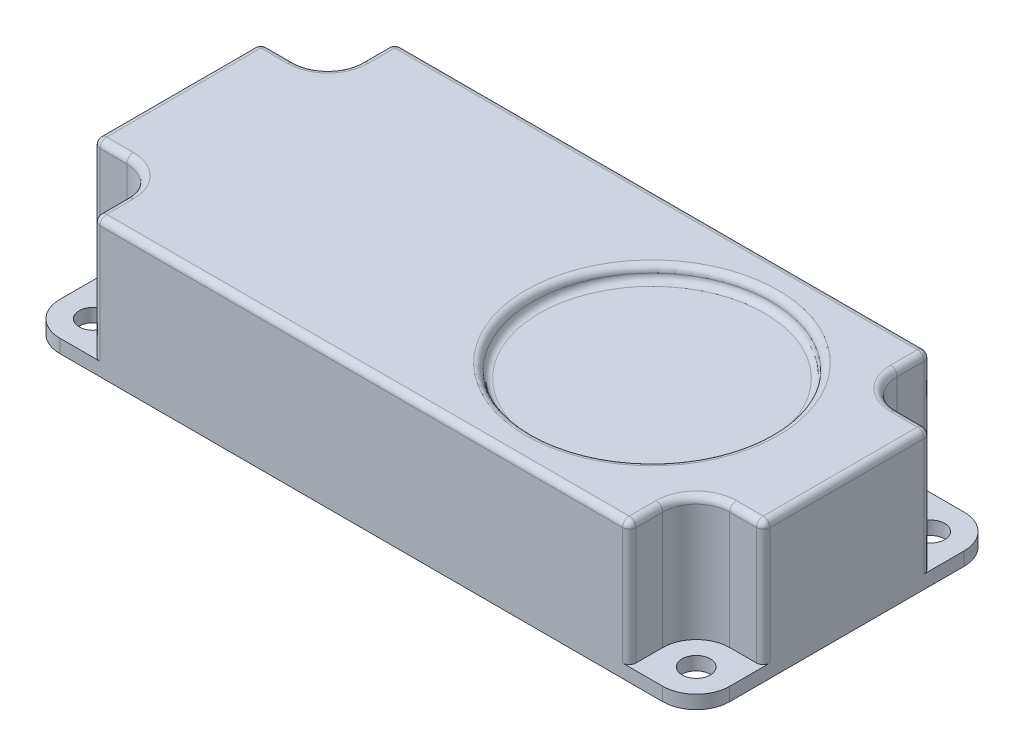
from build123d import *

# Parameters (mm, degrees)
EXTRUDE_1_DEPTH     = 2
EXTRUDE_3_DEPTH     = 18.5
FILLET_1_R          = 1
SKETCH_4_R          = 17.821315346
CUT_EXTRUDE_1_DEPTH = 2
FILLET_2_R          = 1
SKETCH_5_R          = 2.1
CUT_EXTRUDE_2_DEPTH = 2


with BuildPart() as part:
    # 草图1 → 凸台-拉伸1 (new body)
    with BuildSketch(Plane(origin=(0, 0, 0), x_dir=(1, 0, 0), z_dir=(0, 1, 0))):
        with BuildLine():
            Line((-45, -22.5), (45, -22.5))
            ThreePointArc((45, -22.5), (48.535533906, -21.035533906), (50, -17.5))
            Line((50, -17.5), (50, 17.5))
            ThreePointArc((50, 17.5), (48.535533906, 21.035533906), (45, 22.5))
            Line((45, 22.5), (-45, 22.5))
            ThreePointArc((-45, 22.5), (-48.535533906, 21.035533906), (-50, 17.5))
            Line((-50, 17.5), (-50, -17.5))
            ThreePointArc((-50, -17.5), (-48.535533906, -21.035533906), (-45, -22.5))
        make_face()
    extrude(amount=EXTRUDE_1_DEPTH)

    # 草图2 → 凸台-拉伸3 (add)
    with BuildSketch(Plane(origin=(0, 2, 0), x_dir=(1, 0, 0), z_dir=(0, 1, 0))):
        with BuildLine():
            Line((-40, 22.5), (-40, 17.5))
            ThreePointArc((-40, 17.5), (-41.464466094, 13.964466094), (-45, 12.5))
            Line((-45, 12.5), (-50, 12.5))
            Line((-50, 12.5), (-50, -12.5))
            Line((-50, -12.5), (-45, -12.5))
            ThreePointArc((-45, -12.5), (-41.464466094, -13.964466094), (-40, -17.5))
            Line((-40, -17.5), (-40, -22.5))
            Line((-40, -22.5), (40, -22.5))
            Line((40, -22.5), (40, -17.5))
            ThreePointArc((40, -17.5), (41.464466094, -13.964466094), (45, -12.5))
            Line((45, -12.5), (50, -12.5))
            Line((50, -12.5), (50, 12.5))
            Line((50, 12.5), (45, 12.5))
            ThreePointArc((45, 12.5), (41.464466094, 13.964466094), (40, 17.5))
            Line((40, 17.5), (40, 22.5))
            Line((40, 22.5), (-40, 22.5))
        make_face()
    extrude(amount=EXTRUDE_3_DEPTH)

    # 圆角1
    fillet_1_edges = [part.edges().sort_by_distance(p)[0] for p in [
        (40, 11.25, -22.5),
        (-40, 11.25, -22.5),
        (-50, 11.25, -12.5),
        (-50, 11.25, 12.5),
        (-40, 11.25, 22.5),
        (40, 11.25, 22.5),
        (50, 11.25, 12.5),
        (50, 11.25, -12.5),
        (41.464466094, 20.5, -13.964466094),
        (40, 20.5, -20),
        (0, 20.5, -22.5),
        (-40, 20.5, -20),
        (-41.464466094, 20.5, -13.964466094),
        (-47.5, 20.5, -12.5),
        (-50, 20.5, 0),
        (-47.5, 20.5, 12.5),
        (-41.464466094, 20.5, 13.964466094),
        (-40, 20.5, 20),
        (0, 20.5, 22.5),
        (40, 20.5, 20),
        (41.464466094, 20.5, 13.964466094),
        (47.5, 20.5, 12.5),
        (50, 20.5, 0),
        (47.5, 20.5, -12.5),
    ]]
    fillet(fillet_1_edges, radius=FILLET_1_R)

    # 草图4 → 切除-拉伸1 (cut)
    with BuildSketch(Plane(origin=(0, 20.5, 0), x_dir=(1, 0, 0), z_dir=(0, 1, 0))):
        with Locations(Location((20.892434564, 0, 0), (0, 0, 270))):
            Circle(SKETCH_4_R)
    extrude(amount=-CUT_EXTRUDE_1_DEPTH, mode=Mode.SUBTRACT)

    # 圆角2
    fillet_2_edges = [part.edges().sort_by_distance(p)[0] for p in [
        (20.892434564, 18.5, -17.821315346),
        (20.892434564, 20.5, -17.821315346),
    ]]
    fillet(fillet_2_edges, radius=FILLET_2_R - 0.0001)  # a hair under: the kernel refuses the full size

    # 草图5 → 切除-拉伸2 (cut)
    with BuildSketch(Plane(origin=(0, 2, 0), x_dir=(1, 0, 0), z_dir=(0, 1, 0))):
        with Locations(Location((-45, 17.5, 0), (0, 0, 270))):
            Circle(SKETCH_5_R)
        with Locations(Location((45, 17.5, 0), (0, 0, 270))):
            Circle(SKETCH_5_R)
        with Locations(Location((45, -17.5, 0), (0, 0, 270))):
            Circle(SKETCH_5_R)
        with Locations(Location((-45, -17.5, 0), (0, 0, 270))):
            Circle(SKETCH_5_R)
    extrude(amount=-CUT_EXTRUDE_2_DEPTH, mode=Mode.SUBTRACT)


solid = part.part
